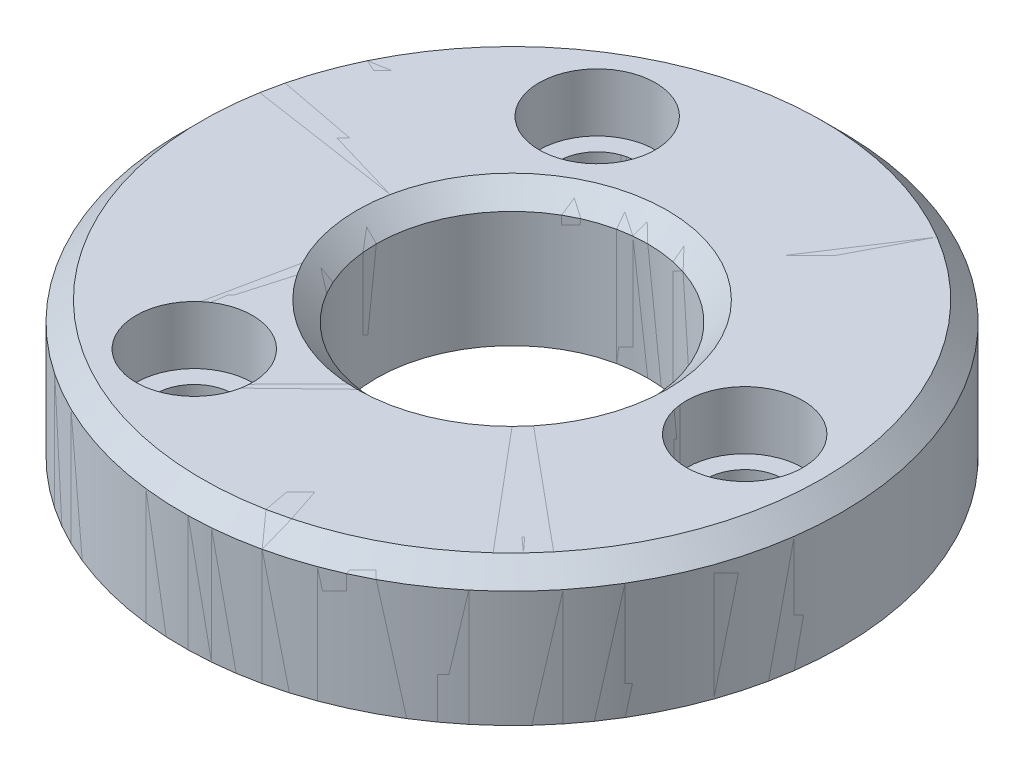
from build123d import *

# Parameters (mm, degrees)
SKETCH_2_R          = 3
SKETCH_2_R_2        = 2
CUT_EXTRUDE_1_DEPTH = 3
SKETCH_3_R          = 2
CUT_EXTRUDE_2_DEPTH = 26.039968051


# Read off the part's stored shape, not the designer's step: 旋转1
with BuildPart() as part:
    # 旋转1 outline → 旋转1 (revolve)
    with BuildSketch(Plane.XY):
        Polygon((7, 6), (7, 0), (17, 0), (17, 6), (16, 7), (8, 7), align=None)
    revolve(axis=Axis((0, 0, 0), (0, 1, 0)))


with BuildPart() as body_2:
    # Revolve 1 2 outline → Revolve 1 2 (revolve)
    with BuildSketch(Plane.XY):
        Polygon((8, 7), (7, 6), (7, 0), (17, 0), (17, 6), (16, 7), align=None)
    revolve(axis=Axis((0, 0, 0), (0, 1, 0)))


with BuildPart() as cut_extrude_1_tool:
    # 草图2 → 切除-拉伸1 (new body)
    # profile 1 of 3: a face of its own
    with BuildSketch(Plane(origin=(0, 7, 0), x_dir=(1, 0, 0), z_dir=(0, 1, 0))):
        with Locations(Location((12, 0, 0), (0, 0, 180))):
            Circle(SKETCH_2_R)
        with Locations(Location((12, 0, 0), (0, 0, 180))):
            Circle(SKETCH_2_R_2, mode=Mode.SUBTRACT)
    # profile 2 of 3: a face of its own
    with BuildSketch(Plane(origin=(0, 7, 0), x_dir=(1, 0, 0), z_dir=(0, 1, 0))):
        with Locations(Location((-6, -10.392304845, 0), (0, 0, 180))):
            Circle(SKETCH_2_R)
        with Locations(Location((-6, -10.392304845, 0), (0, 0, 180))):
            Circle(SKETCH_2_R_2, mode=Mode.SUBTRACT)
    # profile 3 of 3: a face of its own
    with BuildSketch(Plane(origin=(0, 7, 0), x_dir=(1, 0, 0), z_dir=(0, 1, 0))):
        with Locations(Location((-6, 10.392304845, 0), (0, 0, 180))):
            Circle(SKETCH_2_R)
        with Locations(Location((-6, 10.392304845, 0), (0, 0, 180))):
            Circle(SKETCH_2_R_2, mode=Mode.SUBTRACT)
    extrude(amount=-CUT_EXTRUDE_1_DEPTH)


with BuildPart() as part_1:
    add(part.part)

    # 切除-拉伸1: cut by cut_extrude_1_tool
    add(cut_extrude_1_tool.part, mode=Mode.SUBTRACT)


with BuildPart() as body_2_1:
    add(body_2.part)

    # 切除-拉伸1: cut by cut_extrude_1_tool
    add(cut_extrude_1_tool.part, mode=Mode.SUBTRACT)


with BuildPart() as cut_extrude_2_tool:
    # 草图3 → 切除-拉伸2 (new, through all)
    with BuildSketch(Plane(origin=(0, 7, 0), x_dir=(1, 0, 0), z_dir=(0, 1, 0))):
        with Locations(Location((-6, 10.392304845, 0), (0, 0, 180))):
            Circle(SKETCH_3_R)
        with Locations(Location((12, 0, 0), (0, 0, 180))):
            Circle(SKETCH_3_R)
        with Locations(Location((-6, -10.392304845, 0), (0, 0, 180))):
            Circle(SKETCH_3_R)
    extrude(amount=-CUT_EXTRUDE_2_DEPTH)


with BuildPart() as part_2:
    add(part_1.part)

    # 切除-拉伸2: cut by cut_extrude_2_tool
    add(cut_extrude_2_tool.part, mode=Mode.SUBTRACT)


with BuildPart() as body_2_2:
    add(body_2_1.part)

    # 切除-拉伸2: cut by cut_extrude_2_tool
    add(cut_extrude_2_tool.part, mode=Mode.SUBTRACT)


solid = Compound([part_2.part, body_2_2.part])
